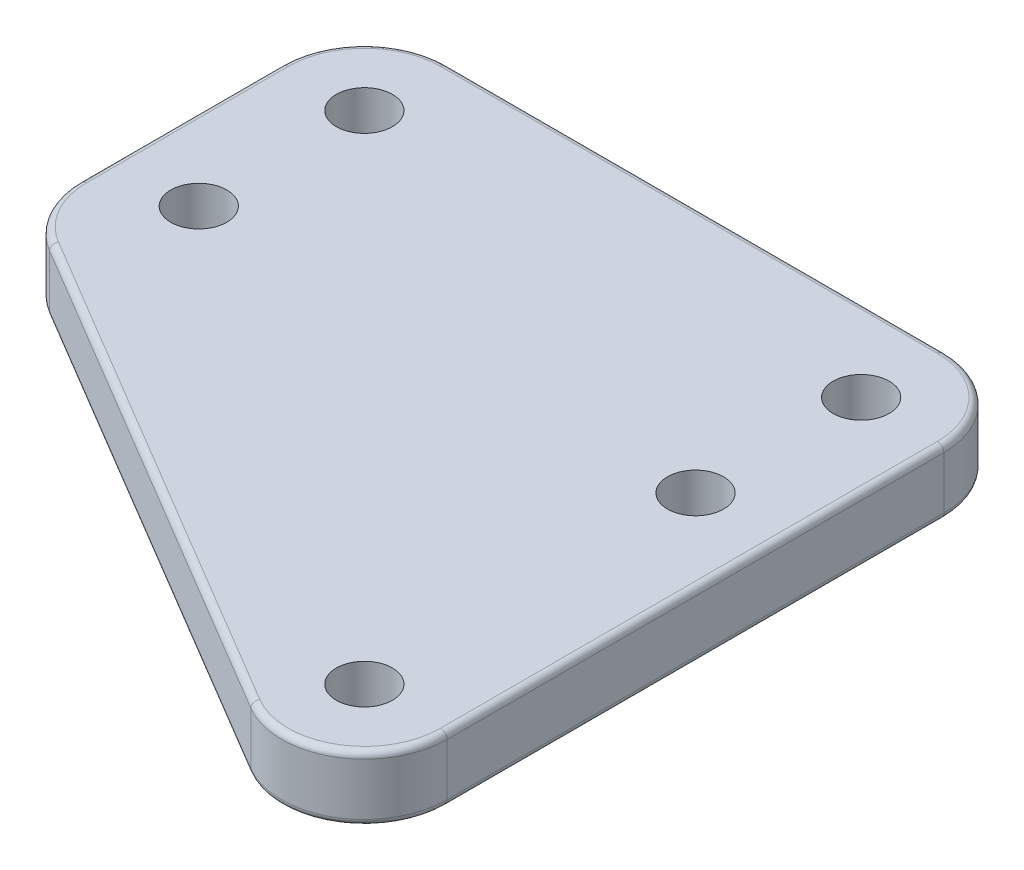
from build123d import *

# Parameters (mm, degrees)
SKETCH1_W           = 50.8
SKETCH1_H           = 25.4
SKETCH1_R           = 2.15
BOSS_EXTRUDE1_DEPTH = 5
FILLET1_R           = 6.35
FILLET2_R           = 6.35
FILLET3_R           = 0.5


with BuildPart() as part:
    # Sketch1 → Boss-Extrude1 (new body)
    # profile 1 of 2: a face of its own
    with BuildSketch(Plane(origin=(0, 0, 0), x_dir=(1, 0, 0), z_dir=(0, 1, 0))):
        with Locations((-25.4, -12.7)):
            Rectangle(SKETCH1_W, SKETCH1_H)
        with Locations(Location((-44.45, -19.05, 0), (0, 0, 270))):
            Circle(SKETCH1_R, mode=Mode.SUBTRACT)
        with Locations(Location((-6.35, -19.05, 0), (0, 0, 270))):
            Circle(SKETCH1_R, mode=Mode.SUBTRACT)
        with Locations(Location((-6.35, -6.35, 0), (0, 0, 270))):
            Circle(SKETCH1_R, mode=Mode.SUBTRACT)
        with Locations(Location((-44.45, -6.35, 0), (0, 0, 270))):
            Circle(SKETCH1_R, mode=Mode.SUBTRACT)
    # profile 2 of 2: a face of its own
    with BuildSketch(Plane(origin=(0, 0, 0), x_dir=(1, 0, 0), z_dir=(0, 1, 0))):
        Polygon((0, -51.838336263), (0, -25.4), (-50.8, -25.4), (-25.653556262, -40.356808445), (-6.35, -51.838336263), align=None)
        with Locations(Location((-6.35, -44.45, 0), (0, 0, 270))):
            Circle(SKETCH1_R, mode=Mode.SUBTRACT)
    extrude(amount=BOSS_EXTRUDE1_DEPTH)

    # Fillet1
    fillet1_edges = [part.edges().sort_by_distance(p)[0] for p in [
        (0, 2.5, 0),
        (-50.8, 2.5, 0),
        (-50.8, 2.5, 25.4),
        (0, 2.5, 51.838336263),
    ]]
    fillet(fillet1_edges, radius=FILLET1_R - 0.0001)  # a hair under: the kernel refuses the full size

    # Fillet2
    fillet2_edges = [part.edges().sort_by_distance(p)[0] for p in [
        (-6.35, 2.5, 51.838336263),
    ]]
    fillet(fillet2_edges, radius=FILLET2_R - 0.0004)  # a hair under: the kernel refuses the full size

    # Fillet3
    fillet3_edges = [part.edges().sort_by_distance(p)[0] for p in [
        (0, 0, 25.400301661),
        (0, 5, 25.400301661),
        (-25.4, 0, 0),
        (-28.645831614, 0, 38.577038322),
        (-50.8, 0, 14.069262895),
        (-49.969763738, 0, 24.927820308),
        (-48.94015735, 0, 1.85984265),
        (-1.85984265, 0, 1.85984265),
        (-25.4, 5, 0),
        (-50.8, 5, 14.069262895),
        (-28.645831614, 5, 38.577038322),
        (-49.969763738, 5, 24.927820308),
        (-48.94015735, 5, 1.85984265),
        (-1.85984265, 5, 1.85984265),
        (-3.210553792, 0, 49.970106285),
        (-3.210553792, 5, 49.970106285),
    ]]
    fillet(fillet3_edges, radius=FILLET3_R)


solid = part.part
